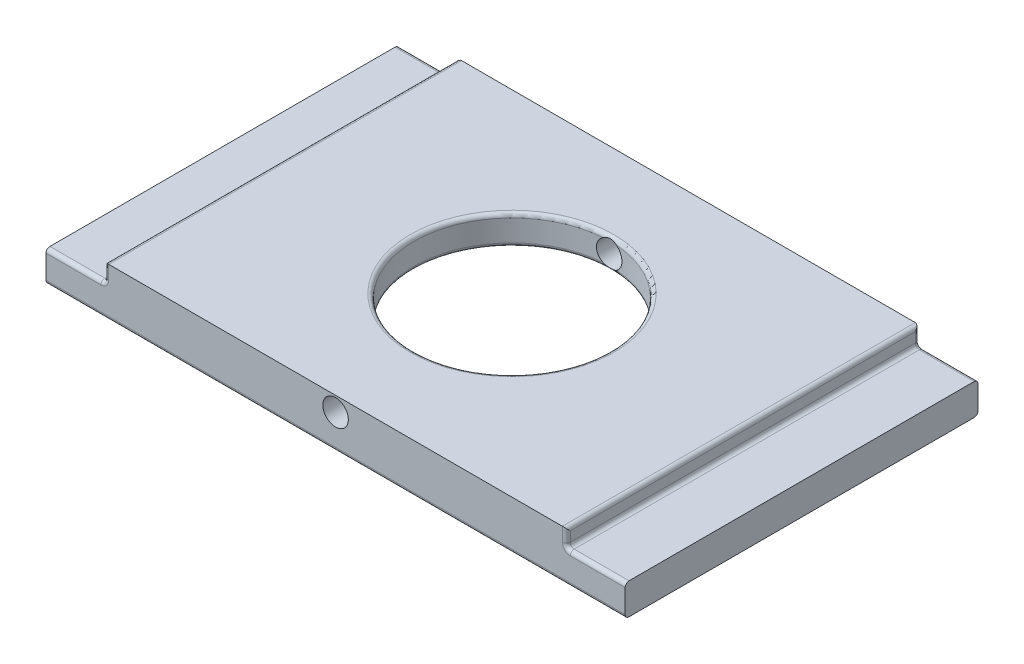
from build123d import *

# Parameters (mm, degrees)
BOSS_EXTRUDE1_DEPTH = 45.72
CUT_EXTRUDE1_REACH  = 94.812
SKETCH2_R           = 12.7
SKETCH4_R           = 19.05
CUT_EXTRUDE2_DEPTH  = 2.54
SKETCH5_R           = 1.651
CUT_EXTRUDE3_DEPTH  = 94.150493289
FILLET1_R           = 0.508


with BuildPart() as part:
    # Sketch1 → Boss-Extrude1 (new body)
    with BuildSketch(Plane.XY):
        Polygon((13.1, 7.855), (5.48, 7.855), (5.48, 3.81), (80.52, 3.81), (80.52, 7.855), (72.9, 7.855), (72.9, 10.16), (13.1, 10.16), align=None)
    extrude(amount=-BOSS_EXTRUDE1_DEPTH)

    # Sketch2 → Cut-Extrude1 (cut, up to next)
    with BuildSketch(Plane.XZ.offset(-3.81), mode=Mode.PRIVATE) as cut_extrude1_sk1:
        with Locations(Location((43, -22.86, 0), (0, 0, 270))):
            Circle(SKETCH2_R)
    cut_extrude1_tool1 = extrude(cut_extrude1_sk1.sketch, amount=-CUT_EXTRUDE1_REACH, mode=Mode.PRIVATE) & part.part
    add(cut_extrude1_tool1.solids().sort_by_distance((43, 3.81, -22.86))[0], mode=Mode.SUBTRACT)

    # Sketch4 → Cut-Extrude2 (cut)
    with BuildSketch(Plane.XZ.offset(-3.81)):
        with Locations(Location((43, -22.86, 0), (0, 0, 270))):
            Circle(SKETCH4_R)
    extrude(amount=-CUT_EXTRUDE2_DEPTH, mode=Mode.SUBTRACT)

    # Sketch5 → Cut-Extrude3 (cut, through all)
    with BuildSketch(Plane.XY):
        with Locations((43, 8.255)):
            Circle(SKETCH5_R)
    extrude(amount=-CUT_EXTRUDE3_DEPTH, mode=Mode.SUBTRACT)

    # Fillet1
    # the kernel refuses this fillet: 0.508 mm, written as the material it adds along each edge
    with BuildSketch(Plane(origin=(43, 6.35, -22.86), x_dir=(0, 0, -1), z_dir=(-1, 0, 0))) as fillet1_piece_1:
        with BuildLine():
            CenterArc((19.05 - FILLET1_R, FILLET1_R), FILLET1_R, 270, 90)
            Line((19.05 - FILLET1_R, 0), (19.05, 0))
            Line((19.05, 0), (19.05, FILLET1_R))
        make_face()
    revolve(axis=Axis((43, 6.35, -22.86), (0, -1, 0)))
    with BuildSketch(Plane(origin=(72.9, 7.855, 0), x_dir=(0, 1, 0), z_dir=(0, 0, -1)), Plane(origin=(13.1, 7.855, 0), x_dir=(-1, 0, 0), z_dir=(0, 0, -1))) as fillet1_piece_2:
        with BuildLine():
            CenterArc((FILLET1_R, FILLET1_R), FILLET1_R, 180, 90)
            Line((0, FILLET1_R), (0, 0))
            Line((0, 0), (FILLET1_R, 0))
        make_face()
    extrude(amount=45.72)
    # the kernel refuses this fillet: 0.508 mm, written as the material it takes off along each edge
    with BuildSketch(Plane(origin=(72.9, 8.363, -45.72), x_dir=(-1, 0, 0), z_dir=(0, 1, 0)), Plane(origin=(13.1, 11.43, -45.72), x_dir=(1, 0, 0), z_dir=(0, -1, 0))) as fillet1_2_piece_1:
        with BuildLine():
            CenterArc((FILLET1_R, FILLET1_R), FILLET1_R, 180, 90)
            Line((0, FILLET1_R), (0, 0))
            Line((0, 0), (FILLET1_R, 0))
        make_face()
    extrude(amount=3.067, mode=Mode.SUBTRACT)
    with BuildSketch(Plane(origin=(72.9, 8.363, 0), x_dir=(-1, 0, 0), z_dir=(0, 1, 0)), Plane(origin=(13.1, 11.43, 0), x_dir=(1, 0, 0), z_dir=(0, -1, 0))) as fillet1_2_piece_2:
        with BuildLine():
            CenterArc((FILLET1_R, -FILLET1_R), FILLET1_R, 90, 90)
            Line((0, -FILLET1_R), (0, 0))
            Line((0, 0), (FILLET1_R, 0))
        make_face()
    extrude(amount=3.067, mode=Mode.SUBTRACT)
    with BuildSketch(Plane(origin=(43, 6.35, -22.86), x_dir=(0, 0, -1), z_dir=(-1, 0, 0))) as fillet1_2_piece_3:
        with BuildLine():
            CenterArc((12.7 + FILLET1_R, -FILLET1_R), FILLET1_R, 90, 90)
            Line((12.7 + FILLET1_R, 0), (12.7, 0))
            Line((12.7, 0), (12.7, -FILLET1_R))
        make_face()
    revolve(axis=Axis((43, 6.35, -22.86), (0, -1, 0)), mode=Mode.SUBTRACT)
    with BuildSketch(Plane(origin=(4.21, 3.81, -45.72), x_dir=(0, 1, 0), z_dir=(1, 0, 0))) as fillet1_2_piece_4:
        with BuildLine():
            CenterArc((FILLET1_R, FILLET1_R), FILLET1_R, 180, 90)
            Line((0, FILLET1_R), (0, 0))
            Line((0, 0), (FILLET1_R, 0))
        make_face()
    extrude(amount=77.58, mode=Mode.SUBTRACT)
    with BuildSketch(Plane(origin=(4.21, 3.81, 0), x_dir=(0, 1, 0), z_dir=(1, 0, 0))) as fillet1_2_piece_5:
        with BuildLine():
            CenterArc((FILLET1_R, -FILLET1_R), FILLET1_R, 90, 90)
            Line((0, -FILLET1_R), (0, 0))
            Line((0, 0), (FILLET1_R, 0))
        make_face()
    extrude(amount=77.58, mode=Mode.SUBTRACT)
    with BuildSketch(Plane(origin=(81.79, 7.855, -45.72), x_dir=(0, -1, 0), z_dir=(-1, 0, 0)), Plane(origin=(12.592, 7.855, 0), x_dir=(0, 0, -1), z_dir=(-1, 0, 0))) as fillet1_2_piece_6:
        with BuildLine():
            CenterArc((FILLET1_R, FILLET1_R), FILLET1_R, 180, 90)
            Line((0, FILLET1_R), (0, 0))
            Line((0, 0), (FILLET1_R, 0))
        make_face()
    extrude(amount=8.382, mode=Mode.SUBTRACT)
    with BuildSketch(Plane(origin=(81.79, 7.855, 0), x_dir=(0, -1, 0), z_dir=(-1, 0, 0)), Plane(origin=(12.592, 7.855, -45.72), x_dir=(0, 0, 1), z_dir=(-1, 0, 0))) as fillet1_2_piece_7:
        with BuildLine():
            CenterArc((FILLET1_R, -FILLET1_R), FILLET1_R, 90, 90)
            Line((0, -FILLET1_R), (0, 0))
            Line((0, 0), (FILLET1_R, 0))
        make_face()
    extrude(amount=8.382, mode=Mode.SUBTRACT)
    with BuildSketch(Plane(origin=(72.9, 10.16, 1.27), x_dir=(-1, 0, 0), z_dir=(0, 0, -1)), Plane(origin=(13.1, 10.16, 1.27), x_dir=(0, -1, 0), z_dir=(0, 0, -1))) as fillet1_2_piece_8:
        with BuildLine():
            CenterArc((FILLET1_R, -FILLET1_R), FILLET1_R, 90, 90)
            Line((0, -FILLET1_R), (0, 0))
            Line((0, 0), (FILLET1_R, 0))
        make_face()
    extrude(amount=48.26, mode=Mode.SUBTRACT)
    with BuildSketch(Plane(origin=(43, 10.16, -22.86), x_dir=(0, 0, -1), z_dir=(-1, 0, 0))) as fillet1_2_piece_9:
        with BuildLine():
            CenterArc((12.7 + FILLET1_R, FILLET1_R), FILLET1_R, 180, 90)
            Line((12.7, FILLET1_R), (12.7, 0))
            Line((12.7, 0), (12.7 + FILLET1_R, 0))
        make_face()
    revolve(axis=Axis((43, 10.16, -22.86), (0, -1, 0)), mode=Mode.SUBTRACT)
    with BuildSketch(Plane(origin=(12.592, 8.363, 0), x_dir=(0, -1, 0), z_dir=(-1, 0, 0))) as fillet1_2_piece_10:
        with BuildLine():
            CenterArc((0.508 + FILLET1_R, -FILLET1_R), FILLET1_R, 90, 90)
            Line((0.508, -FILLET1_R), (0.508, 0))
            Line((0.508, 0), (0.508 + FILLET1_R, 0))
        make_face()
    revolve(axis=Axis((12.592, 8.363, 0), (0, 0, 1)), revolution_arc=90, mode=Mode.SUBTRACT)
    with BuildSketch(Plane(origin=(12.592, 8.363, -45.72), x_dir=(0, -1, 0), z_dir=(-1, 0, 0))) as fillet1_2_piece_11:
        with BuildLine():
            CenterArc((0.508 + FILLET1_R, FILLET1_R), FILLET1_R, 180, 90)
            Line((0.508, FILLET1_R), (0.508, 0))
            Line((0.508, 0), (0.508 + FILLET1_R, 0))
        make_face()
    revolve(axis=Axis((12.592, 8.363, -45.72), (0, 0, 1)), revolution_arc=90, mode=Mode.SUBTRACT)
    with BuildSketch(Plane(origin=(73.408, 8.363, 0), x_dir=(-1, 0, 0), z_dir=(0, 1, 0))) as fillet1_2_piece_12:
        with BuildLine():
            CenterArc((0.508 + FILLET1_R, -FILLET1_R), FILLET1_R, 90, 90)
            Line((0.508, -FILLET1_R), (0.508, 0))
            Line((0.508, 0), (0.508 + FILLET1_R, 0))
        make_face()
    revolve(axis=Axis((73.408, 8.363, 0), (0, 0, 1)), revolution_arc=90, mode=Mode.SUBTRACT)
    with BuildSketch(Plane(origin=(73.408, 8.363, -45.72), x_dir=(-1, 0, 0), z_dir=(0, 1, 0))) as fillet1_2_piece_13:
        with BuildLine():
            CenterArc((0.508 + FILLET1_R, FILLET1_R), FILLET1_R, 180, 90)
            Line((0.508, FILLET1_R), (0.508, 0))
            Line((0.508, 0), (0.508 + FILLET1_R, 0))
        make_face()
    revolve(axis=Axis((73.408, 8.363, -45.72), (0, 0, 1)), revolution_arc=90, mode=Mode.SUBTRACT)


solid = part.part
